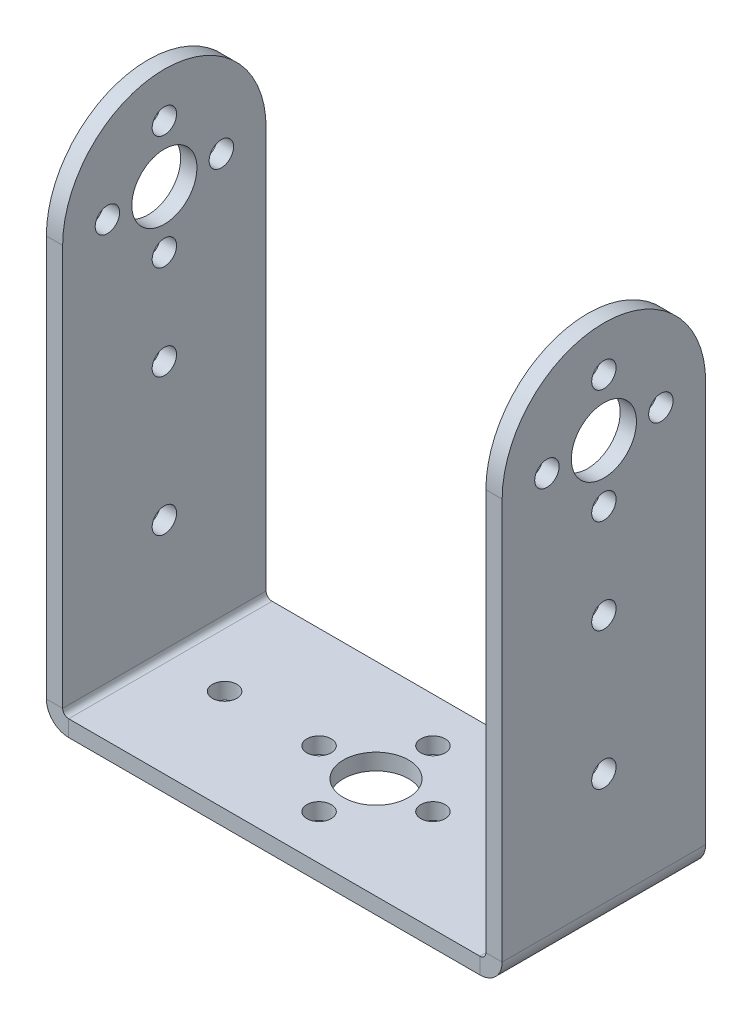
from build123d import *

# Parameters (mm, degrees)
SKETCH_1_W                       = 52
SKETCH_1_H                       = 25
SM_BASE_FLANGE_1_DEPTH           = 2
SM_EDGE_FLANGE_1_STRIP_W         = 9.4732
SM_EDGE_FLANGE_1_STRIP_H         = 2
SM_EDGE_FLANGE_1_STRIP_CUT_DEPTH = 25
SM_EDGE_FLANGE_1_DEPTH           = 25
SM_START                         = 2
SM_EDGE_FLANGE_1_FLAT_DEPTH      = 2
HOLE_WIZARD_3_0_3_1_D            = 3
HOLE_WIZARD_8_0_8_2_D            = 8
HOLE_WIZARD_8_0_8_3_D            = 8
HOLE_WIZARD_3_0_3_2_D            = 3


# Sheet-metal steps are written as plain solids
with BuildPart() as part:
    # Sketch 1 → 基体-法兰1 (new body)
    with BuildSketch(Plane(origin=(0, 0, 0), x_dir=(1, 0, 0), z_dir=(0, 1, 0))):
        Rectangle(SKETCH_1_W, SKETCH_1_H)
    extrude(amount=-SM_BASE_FLANGE_1_DEPTH)

    # 边线-法兰1 strip (across the edge) → 边线-法兰1 strip cut (cut)
    with BuildSketch(Plane(origin=(-26, 0, -12.5), x_dir=(1, 0, 0), z_dir=(0, 0, 1))):
        with Locations((-4, -1)):
            Rectangle(SM_EDGE_FLANGE_1_STRIP_W, SM_EDGE_FLANGE_1_STRIP_H)
    sm_edge_flange_1_strip_cut = extrude(amount=SM_EDGE_FLANGE_1_STRIP_CUT_DEPTH, mode=Mode.SUBTRACT)

    # 边线-法兰1 bend section (across the edge) → 边线-法兰1 (add)
    with BuildSketch(Plane(origin=(-26, 0, -12.5), x_dir=(1, 0, 0), z_dir=(0, 0, 1))):
        with BuildLine():
            Line((-2, 0.7366), (0, 0.7366))
            ThreePointArc((0, 0.7366), (0.215745145, 0.215745145), (0.7366, 0))
            Line((0.7366, 0), (0.7366, -2))
            ThreePointArc((0.7366, -2), (-1.198468417, -1.198468417), (-2, 0.7366))
        make_face()
    sm_edge_flange_1 = extrude(amount=SM_EDGE_FLANGE_1_DEPTH)

    # 边线-法兰1 profile (on flange) → 边线-法兰1 flat (add)
    with BuildSketch(Plane.ZY.offset(26).offset(SM_START)):
        with BuildLine():
            ThreePointArc((12.5, 50), (0, 62.5), (-12.5, 50))
            Line((-12.5, 50), (-12.5, 0.7366))
            Line((-12.5, 0.7366), (12.5, 0.7366))
            Line((12.5, 0.7366), (12.5, 50))
        make_face()
    sm_edge_flange_1_flat = extrude(amount=-SM_EDGE_FLANGE_1_FLAT_DEPTH)

    # 镜向1: 边线-法兰1 strip cut, 边线-法兰1, 边线-法兰1 flat across plane
    add(sm_edge_flange_1_strip_cut.mirror(Plane(origin=(0, 0, 0), x_dir=(0, 0, 1), z_dir=(1, 0, 0))), mode=Mode.SUBTRACT)
    add(sm_edge_flange_1.mirror(Plane(origin=(0, 0, 0), x_dir=(0, 0, 1), z_dir=(1, 0, 0))))
    add(sm_edge_flange_1_flat.mirror(Plane(origin=(0, 0, 0), x_dir=(0, 0, 1), z_dir=(1, 0, 0))))

    # Ø3.0 (3) 直径孔1 (through all)
    with Locations(Plane(origin=(0, -2, 0), x_dir=(-1, 0, 0), z_dir=(0, -1, 0))):
        with Locations((0, 7), (0, -7), (7, 0), (18.6, 0), (-7, 0), (-18.6, 0)):
            Hole(HOLE_WIZARD_3_0_3_1_D / 2)

    # Ø8.0 (8) 直径孔2 (through all)
    with Locations(Plane(origin=(0, -2, 0), x_dir=(-1, 0, 0), z_dir=(0, -1, 0))):
        with Locations((0, 0)):
            Hole(HOLE_WIZARD_8_0_8_2_D / 2)

    # Ø8.0 (8) 直径孔3 (through all)
    with Locations(Plane.ZY.offset(28)):
        with Locations((0, 50)):
            Hole(HOLE_WIZARD_8_0_8_3_D / 2)

    # Ø3.0 (3) 直径孔2 (through all)
    with Locations(Plane.ZY.offset(28)):
        with Locations((-7, 50), (7, 50), (0, 57), (0, 43), (0, 31.4), (0, 14.53)):
            Hole(HOLE_WIZARD_3_0_3_2_D / 2)


solid = part.part
